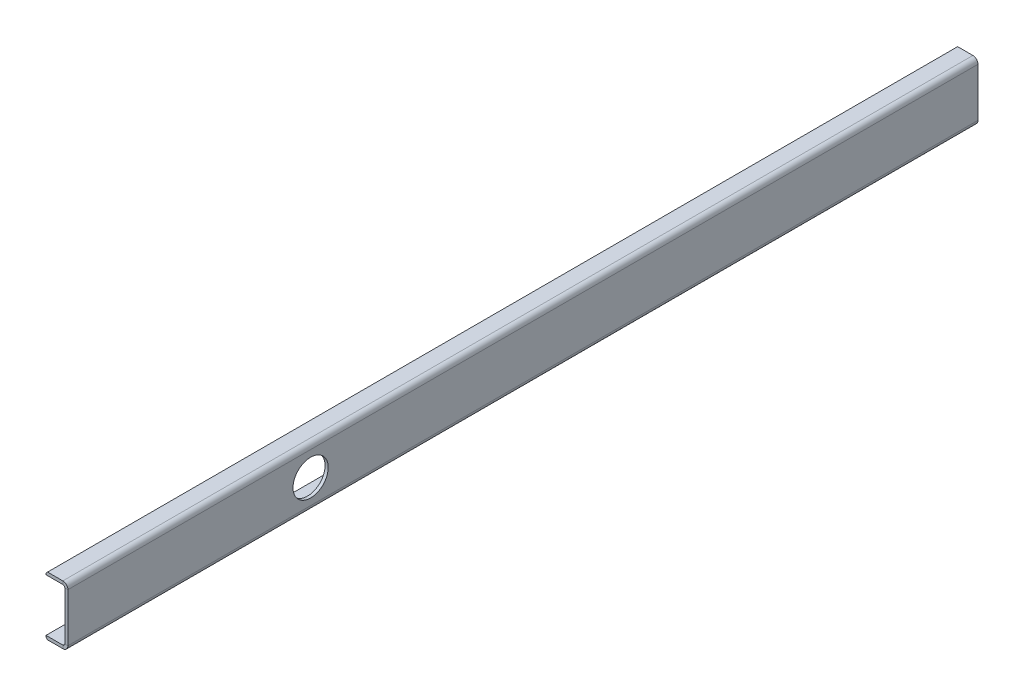
from build123d import *

# Parameters (mm, degrees)
SM_BASE_FLANGE_1_DEPTH = 2325
SKETCH_6_R             = 45
CUT_EXTRUDE_1_DEPTH    = 10
CHAMFER_2_SIZE         = 4


# Sheet-metal steps are written as plain solids
with BuildPart() as part:
    # Sketch 1 → 基体-法兰1 (new body)
    with BuildSketch(Plane.XY):
        with BuildLine():
            Line((0, 0), (43, 0))
            ThreePointArc((43, 0), (52.192388155, -3.807611845), (56, -13))
            Line((56, -13), (56, -137))
            ThreePointArc((56, -137), (52.192388155, -146.192388155), (43, -150))
            Line((43, -150), (0, -150))
            Line((0, -150), (0, -142))
            Line((0, -142), (43, -142))
            ThreePointArc((43, -142), (46.535533906, -140.535533906), (48, -137))
            Line((48, -137), (48, -13))
            ThreePointArc((48, -13), (46.535533906, -9.464466094), (43, -8))
            Line((43, -8), (0, -8))
            Line((0, -8), (0, 0))
        make_face()
    extrude(amount=SM_BASE_FLANGE_1_DEPTH)

    # 草图6 → 切除-拉伸1 (cut)
    with BuildSketch(Plane(origin=(56, 0, 0), x_dir=(0, 0, -1), z_dir=(1, 0, 0))):
        with Locations(Location((-1705, -75, 0), (0, 0, 90))):
            Circle(SKETCH_6_R)
    extrude(amount=-CUT_EXTRUDE_1_DEPTH, mode=Mode.SUBTRACT)

    # 倒角2
    chamfer_2_edges = [part.edges().sort_by_distance(p)[0] for p in [
        (0, 0, 1162.5),
        (0, -150, 1162.5),
    ]]
    chamfer(chamfer_2_edges, length=CHAMFER_2_SIZE)


solid = part.part
